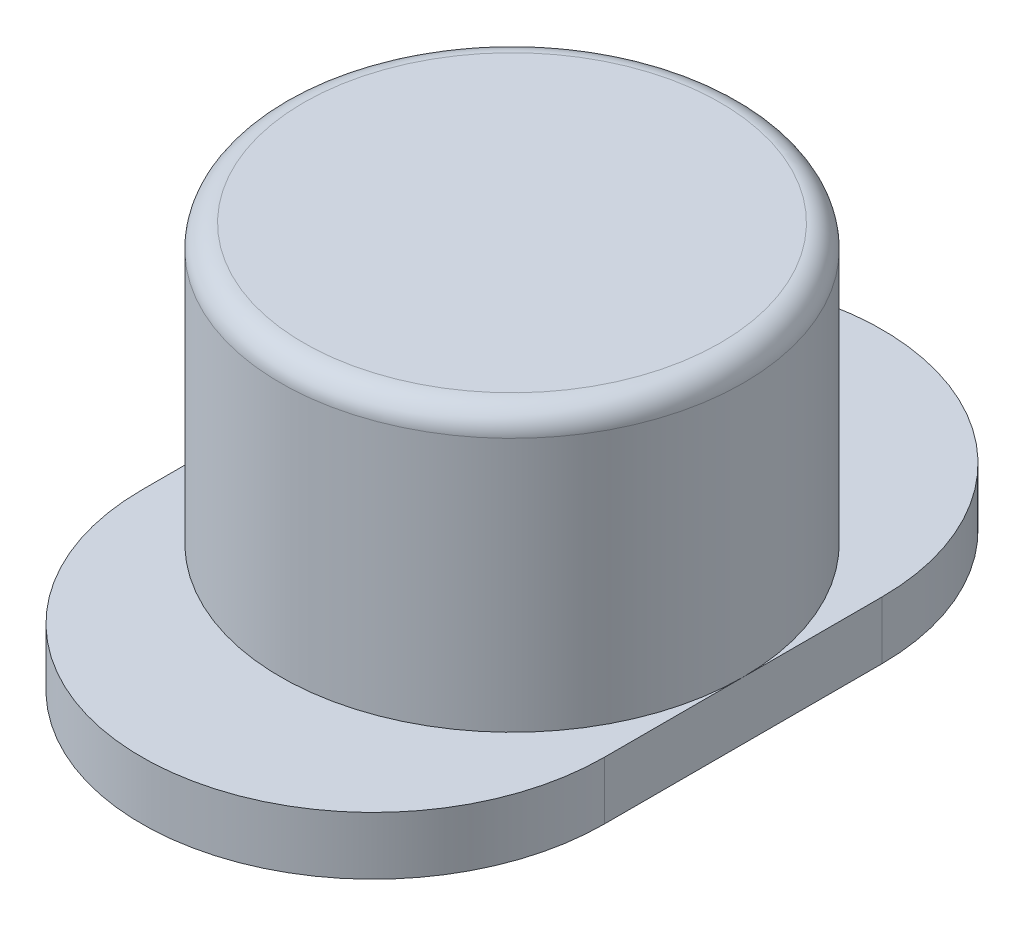
from build123d import *

# Parameters (mm, degrees)
SKETCH2_W          = 3.5
SKETCH2_H          = 2.5
CUT_EXTRUDE1_DEPTH = 3.5
FILLET1_R          = 0.5
CUT_EXTRUDE2_DEPTH = 14.43735465


with BuildPart() as part:
    # Sketch1 → Revolve1 (revolve)
    with BuildSketch(Plane.XY):
        Polygon((0, 7.25), (5, 7.25), (5, 1.25), (8, 1.25), (8, 0), (0, 0), align=None)
    revolve(axis=Axis((0, 7.25, 0), (0, -1, 0)))

    # Sketch2 → Cut-Extrude1 (cut)
    with BuildSketch(Plane.XZ):
        Rectangle(SKETCH2_W, SKETCH2_H)
    extrude(amount=-CUT_EXTRUDE1_DEPTH, mode=Mode.SUBTRACT)

    # Fillet1
    fillet1_edges = [part.edges().sort_by_distance(p)[0] for p in [
        (-5, 7.25, 0),
    ]]
    fillet(fillet1_edges, radius=FILLET1_R)

    # Sketch3 → Cut-Extrude2 (cut, through all)
    with BuildSketch(Plane(origin=(0, 0, 0), x_dir=(1, 0, 0), z_dir=(0, 1, 0))):
        with BuildLine():
            Line((-15, -3), (-15, 3))
            ThreePointArc((-15, 3), (0, 18), (15, 3))
            Line((15, 3), (15, -3))
            ThreePointArc((15, -3), (0, -18), (-15, -3))
        make_face()
        with BuildLine():
            Line((-5, -3), (-5, 3))
            ThreePointArc((-5, 3), (0, 8), (5, 3))
            Line((5, 3), (5, -3))
            ThreePointArc((5, -3), (0, -8), (-5, -3))
        make_face(mode=Mode.SUBTRACT)
    extrude(amount=CUT_EXTRUDE2_DEPTH, mode=Mode.SUBTRACT)


solid = part.part
